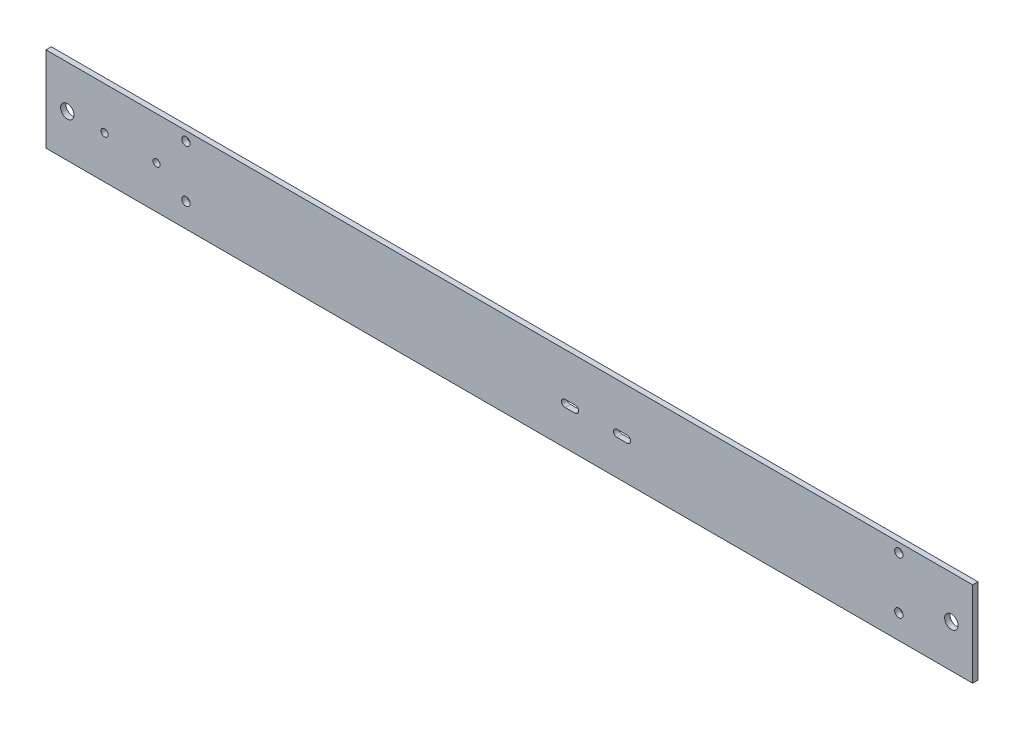
from build123d import *

# Parameters (mm, degrees)
SKETCH1_W                    = 3.175
SKETCH1_H                    = 50.8
BOSS_EXTRUDE1_DEPTH          = 552.45
SIDEHOLES_SKETCH4_R          = 4
SIDEHOLES_SKETCH4_R_2        = 2.5
SIDEHOLES_SKETCH4_R_3        = 2.1
SIDEHOLES_CUT_EXTRUDE3_DEPTH = 555.789800848


with BuildPart() as part:
    # Sketch1 → Boss-Extrude1 (new body)
    with BuildSketch(Plane(origin=(0, 0, 0), x_dir=(0, 0, -1), z_dir=(1, 0, 0))):
        with Locations((-1.5875, 25.4)):
            Rectangle(SKETCH1_W, SKETCH1_H)
    extrude(amount=BOSS_EXTRUDE1_DEPTH)

    # SideHoles-Sketch4 → SideHoles-Cut-Extrude3 (cut, through all)
    with BuildSketch(Plane.XY.offset(3.175)):
        with Locations((12.7, 25.4)):
            Circle(SIDEHOLES_SKETCH4_R)
        with Locations((539.75, 25.4)):
            Circle(SIDEHOLES_SKETCH4_R)
        with Locations((83.425, 45.3)):
            Circle(SIDEHOLES_SKETCH4_R_2)
        with Locations((83.425, 14.3)):
            Circle(SIDEHOLES_SKETCH4_R_2)
        with Locations((508.425, 45.3)):
            Circle(SIDEHOLES_SKETCH4_R_2)
        with Locations((508.425, 14.3)):
            Circle(SIDEHOLES_SKETCH4_R_2)
        with Locations((34.9, 25.4)):
            Circle(SIDEHOLES_SKETCH4_R_3)
        with Locations((65.9, 25.4)):
            Circle(SIDEHOLES_SKETCH4_R_3)
        with BuildLine():
            Line((309.425, 25.1), (315.425, 25.1))
            ThreePointArc((315.425, 25.1), (317.525, 23), (315.425, 20.9))
            Line((315.425, 20.9), (309.425, 20.9))
            ThreePointArc((309.425, 20.9), (307.325, 23), (309.425, 25.1))
        make_face()
        with BuildLine():
            Line((340.425, 25.1), (346.425, 25.1))
            ThreePointArc((346.425, 25.1), (348.525, 23), (346.425, 20.9))
            Line((346.425, 20.9), (340.425, 20.9))
            ThreePointArc((340.425, 20.9), (338.325, 23), (340.425, 25.1))
        make_face()
    extrude(amount=-SIDEHOLES_CUT_EXTRUDE3_DEPTH, mode=Mode.SUBTRACT)


solid = part.part
